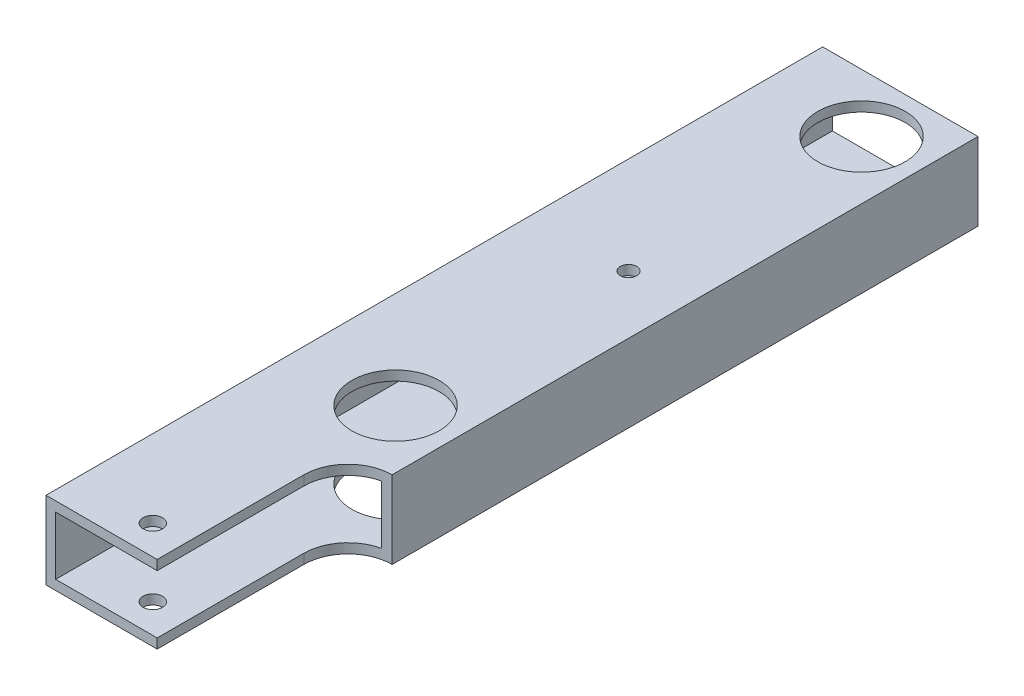
from build123d import *

# Parameters (mm, degrees)
SKETCH1_W           = 50.8
SKETCH1_H           = 25.4
SKETCH1_W_2         = 44.45
SKETCH1_H_2         = 19.05
BOSS_EXTRUDE1_DEPTH = 254
SKETCH2_R           = 14.2875
CUT_EXTRUDE1_DEPTH  = 261.272549455
SKETCH3_R           = 3.175
CUT_EXTRUDE2_DEPTH  = 261.272549455
CUT_EXTRUDE3_DEPTH  = 261.272549455
SKETCH5_R           = 2.667
CUT_EXTRUDE4_DEPTH  = 261.272549455
CUT_EXTRUDE5_REACH  = 262.273
SKETCH6_R           = 6.35


with BuildPart() as part:
    # Sketch1 → Boss-Extrude1 (new body)
    with BuildSketch(Plane.XY):
        with Locations((25.4, 12.7)):
            Rectangle(SKETCH1_W, SKETCH1_H)
        with Locations((25.4, 12.7)):
            Rectangle(SKETCH1_W_2, SKETCH1_H_2, mode=Mode.SUBTRACT)
    extrude(amount=BOSS_EXTRUDE1_DEPTH)

    # Sketch2 → Cut-Extrude1 (cut, through all)
    with BuildSketch(Plane(origin=(0, 25.4, 0), x_dir=(1, 0, 0), z_dir=(0, 1, 0))):
        with Locations((31.75, -19.05)):
            Circle(SKETCH2_R)
        with Locations((31.75, -171.45)):
            Circle(SKETCH2_R)
    extrude(amount=-CUT_EXTRUDE1_DEPTH, mode=Mode.SUBTRACT)

    # Sketch3 → Cut-Extrude2 (cut, through all)
    with BuildSketch(Plane(origin=(0, 25.4, 0), x_dir=(1, 0, 0), z_dir=(0, 1, 0))):
        with Locations((25.4, -244.475)):
            Circle(SKETCH3_R)
    extrude(amount=-CUT_EXTRUDE2_DEPTH, mode=Mode.SUBTRACT)

    # Sketch4 → Cut-Extrude3 (cut, through all)
    with BuildSketch(Plane(origin=(0, 25.4, 0), x_dir=(1, 0, 0), z_dir=(0, 1, 0))):
        with BuildLine():
            Line((36.358855328, -254), (36.358855328, -206.035443665))
            ThreePointArc((36.358855328, -206.035443665), (40.588568674, -195.824012339), (50.8, -191.594298992))
            Line((50.8, -191.594298992), (50.8, -254))
            Line((50.8, -254), (36.358855328, -254))
        make_face()
    extrude(amount=-CUT_EXTRUDE3_DEPTH, mode=Mode.SUBTRACT)

    # Sketch5 → Cut-Extrude4 (cut, through all)
    with BuildSketch(Plane.XZ):
        with Locations((31.75, 95.25)):
            Circle(SKETCH5_R)
    extrude(amount=-CUT_EXTRUDE4_DEPTH, mode=Mode.SUBTRACT)

    # Sketch6 → Cut-Extrude5 (cut, up to next)
    with BuildSketch(Plane(origin=(0, 0, 0), x_dir=(1, 0, 0), z_dir=(0, 1, 0)), mode=Mode.PRIVATE) as cut_extrude5_sk1:
        with Locations((31.75, -96.395770561)):
            Circle(SKETCH6_R)
    cut_extrude5_tool1 = extrude(cut_extrude5_sk1.sketch, amount=CUT_EXTRUDE5_REACH, mode=Mode.PRIVATE) & part.part
    add(cut_extrude5_tool1.solids().sort_by_distance((31.75, 0, 96.395771))[0], mode=Mode.SUBTRACT)


solid = part.part
